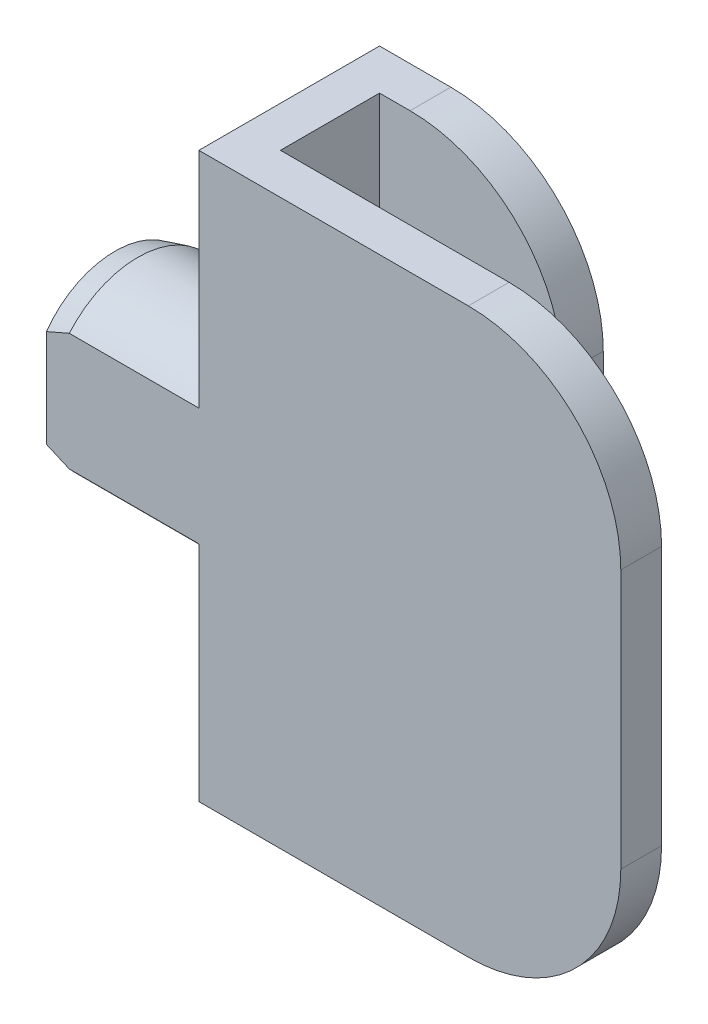
from build123d import *

# Parameters (mm, degrees)
BOSS_EXTRUDE1_DEPTH = 18.5
SKETCH3_R           = 5.925
BOSS_EXTRUDE2_DEPTH = 10
SKETCH5_W           = 13.896314966
SKETCH5_H           = 3.370486285
CUT_EXTRUDE2_DEPTH  = 46.255082587
CHAMFER1_SIZE       = 1.5
CHAMFER1_SIZE2      = 0.401923789
CUT_EXTRUDE4_REACH  = 35.282
SKETCH7_W           = 8.5
SKETCH7_H           = 1.15
SKETCH9_W           = 14.675
SKETCH9_H           = 1.5
BOSS_EXTRUDE5_DEPTH = 1.8
FILLET8_R           = 1.5
SKETCH10_W          = 2.675
SKETCH10_H          = 1.5
BOSS_EXTRUDE6_DEPTH = 0.875
FILLET9_R           = 10
FILLET10_R          = 10


# Some blends are built 0.0001 mm under size
with BuildPart() as part:
    # Sketch2 → Boss-Extrude1 (new, symmetric)
    with BuildSketch(Plane(origin=(0, 0, 0), x_dir=(1, 0, 0), z_dir=(0, 1, 0))):
        Polygon((12, 3.25), (0, 3.25), (0, -3.25), (25, -3.25), (25, -5.925), (-2.675, -5.925), (-2.675, 5.925), (12, 5.925), align=None)
    extrude(amount=BOSS_EXTRUDE1_DEPTH, both=True)

    # Sketch3 → Boss-Extrude2 (add)
    with BuildSketch(Plane.ZY.offset(2.675)):
        with Locations(Location((1.425, 0, 0), (0, 0, 319.419581344))):
            Circle(SKETCH3_R)
    extrude(amount=BOSS_EXTRUDE2_DEPTH)

    # Sketch5 → Cut-Extrude2 (cut, through all)
    with BuildSketch(Plane(origin=(0, 18.5, 0), x_dir=(1, 0, 0), z_dir=(0, 1, 0))):
        with Locations((-9.623157483, -7.610243143)):
            Rectangle(SKETCH5_W, SKETCH5_H)
    extrude(amount=-CUT_EXTRUDE2_DEPTH, mode=Mode.SUBTRACT)

    # Chamfer1
    chamfer1_edges = [part.edges().sort_by_distance(p)[0] for p in [
        (-12.675, 0, -4.5),
    ]]
    chamfer1_side = [part.faces().sort_by_distance(p)[0] for p in [
        (-7.675, 0, -4.5),
    ]]
    chamfer(chamfer1_edges, length=CHAMFER1_SIZE, length2=CHAMFER1_SIZE2, reference=chamfer1_side[0])

    # Sketch7 → Cut-Extrude4 (cut, up to next)
    with BuildSketch(Plane(origin=(0, 0, -5.925), x_dir=(-1, 0, 0), z_dir=(0, 0, -1)), mode=Mode.PRIVATE) as cut_extrude4_sk1:
        with Locations((-7.75, -17.925)):
            Rectangle(SKETCH7_W, SKETCH7_H)
    cut_extrude4_tool1 = extrude(cut_extrude4_sk1.sketch, amount=-CUT_EXTRUDE4_REACH, mode=Mode.PRIVATE) & part.part
    add(cut_extrude4_tool1.solids().sort_by_distance((7.75, -17.925, -5.925))[0], mode=Mode.SUBTRACT)

    # Sketch9 → Boss-Extrude5 (add)
    with BuildSketch(Plane.XY.offset(-3.25)):
        with Locations((4.6625, -19.25)):
            Rectangle(SKETCH9_W, SKETCH9_H)
        with BuildLine():
            Line((11, -17.35), (10, -17.35))
            ThreePointArc((10, -17.35), (10.5, -17.85), (11, -17.35))
        make_face()
    extrude(amount=-BOSS_EXTRUDE5_DEPTH)

    # Fillet8
    fillet8_edges = [part.edges().sort_by_distance(p)[0] for p in [
        (-1.3375, -18.5, -3.25),
    ]]
    fillet(fillet8_edges, radius=FILLET8_R - 0.0001)  # a hair under: the kernel refuses the full size

    # Sketch10 → Boss-Extrude6 (add)
    with BuildSketch(Plane(origin=(0, 0, -5.05), x_dir=(-1, 0, 0), z_dir=(0, 0, -1))):
        with Locations((1.3375, -19.25)):
            Rectangle(SKETCH10_W, SKETCH10_H)
    extrude(amount=BOSS_EXTRUDE6_DEPTH)

    # Fillet9
    # the kernel refuses this fillet: 10 mm, written as the material it adds along each edge
    with BuildSketch(Plane(origin=(0, -20, -5.05), x_dir=(1, 0, 0), z_dir=(0, 1, 0))) as fillet9_piece_1:
        with BuildLine():
            CenterArc((4.090767043, 10), FILLET9_R, 245.853152003, 24.146847997)
            Line((0, 0.875), (0, 0))
            Line((0, 0), (4.090767043, 0))
        make_face()
    extrude(amount=1.5)

    # Fillet10
    fillet10_edges = [part.edges().sort_by_distance(p)[0] for p in [
        (25, 18.5, 4.5875),
        (12, 18.5, -4.5875),
        (25, -18.5, 4.5875),
    ]]
    fillet(fillet10_edges, radius=FILLET10_R)


solid = part.part
